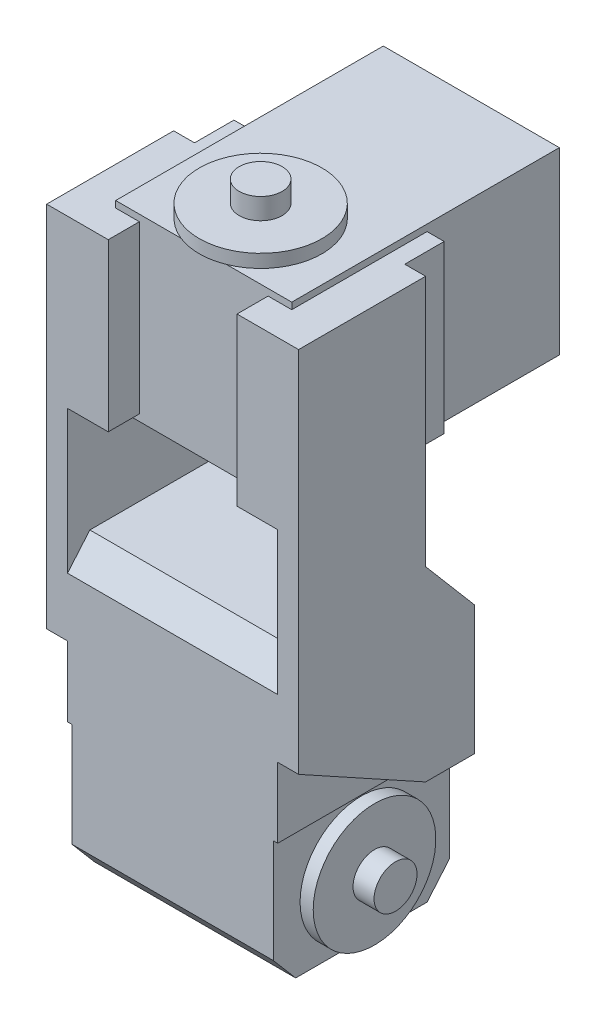
from build123d import *

# Parameters (mm, degrees)
SKETCH1_W                 = 46
SKETCH1_H                 = 40.2
BOSS_EXTRUDE1_DEPTH       = 65.1
SKETCH3_R                 = 14
BOSS_EXTRUDE2_DEPTH       = 3
SKETCH4_R                 = 4.9
BOSS_EXTRUDE3_DEPTH       = 4.8
SKETCH7_W                 = 40.2
SKETCH7_H                 = 35.4
BOSS_EXTRUDE6_DEPTH       = 1
CHAMFER1_SIZE             = 6
CHAMFER1_SIZE2            = 5.1
MIRROR3_START             = 44.200099823
MIRROR3_OUTLINE_W         = 50
MIRROR3_OUTLINE_H         = 11
MIRROR3_DEPTH             = 3.885890521
CHAMFER1_OF_MIRROR8_SIZE2 = 5.1
CHAMFER1_OF_MIRROR8_SIZE  = 6
BOSS_EXTRUDE7_DEPTH       = 4.7625
SKETCH9_W                 = 40.2
SKETCH9_H                 = 61.1
BOSS_EXTRUDE8_DEPTH       = 41
SKETCH10_W                = 38
SKETCH10_H                = 38
BOSS_EXTRUDE9_DEPTH       = 9.3
SKETCH11_R                = 14
BOSS_EXTRUDE10_DEPTH      = 3
SKETCH12_R                = 4.9
BOSS_EXTRUDE11_DEPTH      = 4.8


# Read off the part's stored shape, not the designer's step: Mirror3
with BuildPart() as part:
    # Sketch1 → Boss-Extrude1 (new body)
    with BuildSketch(Plane(origin=(0, -14.5, 0), x_dir=(-1, 0, 0), z_dir=(0, 1, 0))):
        Rectangle(SKETCH1_W, SKETCH1_H)
    extrude(amount=BOSS_EXTRUDE1_DEPTH)

    # Sketch3 → Boss-Extrude2 (add)
    with BuildSketch(Plane.ZY.offset(-23)):
        Circle(SKETCH3_R)
    extrude(amount=-BOSS_EXTRUDE2_DEPTH)

    # Sketch4 → Boss-Extrude3 (add)
    with BuildSketch(Plane(origin=(26, 0, 0), x_dir=(0, 0, -1), z_dir=(1, 0, 0))):
        with Locations(Location((0, 0, 0), (0, 0, 180))):
            Circle(SKETCH4_R)
    extrude(amount=BOSS_EXTRUDE3_DEPTH)

    # Sketch7 → Boss-Extrude6 (add)
    with BuildSketch(Plane.ZY.offset(23)):
        with Locations((0, 32.9)):
            Rectangle(SKETCH7_W, SKETCH7_H)
    boss_extrude6 = extrude(amount=BOSS_EXTRUDE6_DEPTH)

    # Mirror1: Boss-Extrude6 across plane
    add(boss_extrude6.mirror(Plane(origin=(0, 0, 0), x_dir=(0, 0, 1), z_dir=(1, 0, 0))))

    # Chamfer1
    chamfer1_edges = [part.edges().sort_by_distance(p)[0] for p in [
        (0, 50.6, 20.1),
    ]]
    chamfer1_side = [part.faces().sort_by_distance(p)[0] for p in [
        (0, 18.392982971, 20.1),
    ]]
    chamfer(chamfer1_edges, length=CHAMFER1_SIZE, length2=CHAMFER1_SIZE2, reference=chamfer1_side[0])

    # Mirror3 outline → Mirror3 (cut)
    with BuildSketch(Plane(origin=(0, 0, 0), x_dir=(1, 0, 0), z_dir=(0, 0.6476484200955404, -0.7619393177594594)).offset(MIRROR3_START)):
        with Locations((0, -24.5)):
            Rectangle(MIRROR3_OUTLINE_W, MIRROR3_OUTLINE_H)
    mirror3 = extrude(amount=MIRROR3_DEPTH, mode=Mode.SUBTRACT)

    # Mirror8: Mirror3 across plane
    add(mirror3.mirror(Plane.ZX.offset(18.05)), mode=Mode.SUBTRACT)

    # Chamfer1 of Mirror8
    chamfer1_of_mirror8_edges = [part.edges().sort_by_distance(p)[0] for p in [
        (0, -14.5, 20.1),
    ]]
    chamfer(chamfer1_of_mirror8_edges, length=CHAMFER1_OF_MIRROR8_SIZE, length2=CHAMFER1_OF_MIRROR8_SIZE2)

    # Sketch8 → Boss-Extrude7 (add)
    with BuildSketch(Plane(origin=(24, 0, 0), x_dir=(0, 0, -1), z_dir=(1, 0, 0))):
        Polygon((20.1, 15.2), (8.9, 15.2), (-20.1, 31.2), (-20.1, 115.2), (8.9, 115.2), (8.9, 57.776470588), (20.1, 44.6), align=None)
    boss_extrude7 = extrude(amount=BOSS_EXTRUDE7_DEPTH)

    # Mirror4: Boss-Extrude7 across plane
    add(boss_extrude7.mirror(Plane(origin=(0, 0, 0), x_dir=(0, 0, 1), z_dir=(1, 0, 0))))



with BuildPart() as body_2:
    # Sketch9 → Boss-Extrude8 (new body)
    with BuildSketch(Plane(origin=(0, 116.7, 0), x_dir=(-1, 0, 0), z_dir=(0, 1, 0))):
        with Locations((0, -17.55)):
            Rectangle(SKETCH9_W, SKETCH9_H)
    extrude(amount=-BOSS_EXTRUDE8_DEPTH)


with BuildPart() as part_1:
    add(part.part)

    add(body_2.part)  # Boss-Extrude9 merges body 2
    # Sketch10 → Boss-Extrude9 (add)
    with BuildSketch(Plane.ZY.offset(-24)):
        with Locations((1.1, 96.2)):
            Rectangle(SKETCH10_W, SKETCH10_H)
    boss_extrude9 = extrude(amount=BOSS_EXTRUDE9_DEPTH)

    # Mirror6: Boss-Extrude9 across plane
    add(boss_extrude9.mirror(Plane(origin=(0, 0, 0), x_dir=(0, 0, 1), z_dir=(1, 0, 0))))

    # Sketch11 → Boss-Extrude10 (add)
    with BuildSketch(Plane(origin=(0, 116.7, 0), x_dir=(-1, 0, 0), z_dir=(0, 1, 0))):
        with Locations(Location((0, 0, 0), (0, 0, 68.213210702))):
            Circle(SKETCH11_R)
    extrude(amount=BOSS_EXTRUDE10_DEPTH)

    # Sketch12 → Boss-Extrude11 (add)
    with BuildSketch(Plane(origin=(0, 119.7, 0), x_dir=(1, 0, 0), z_dir=(0, 1, 0))):
        with Locations(Location((0, 0, 0), (0, 0, 270))):
            Circle(SKETCH12_R)
    extrude(amount=BOSS_EXTRUDE11_DEPTH)


solid = part_1.part
